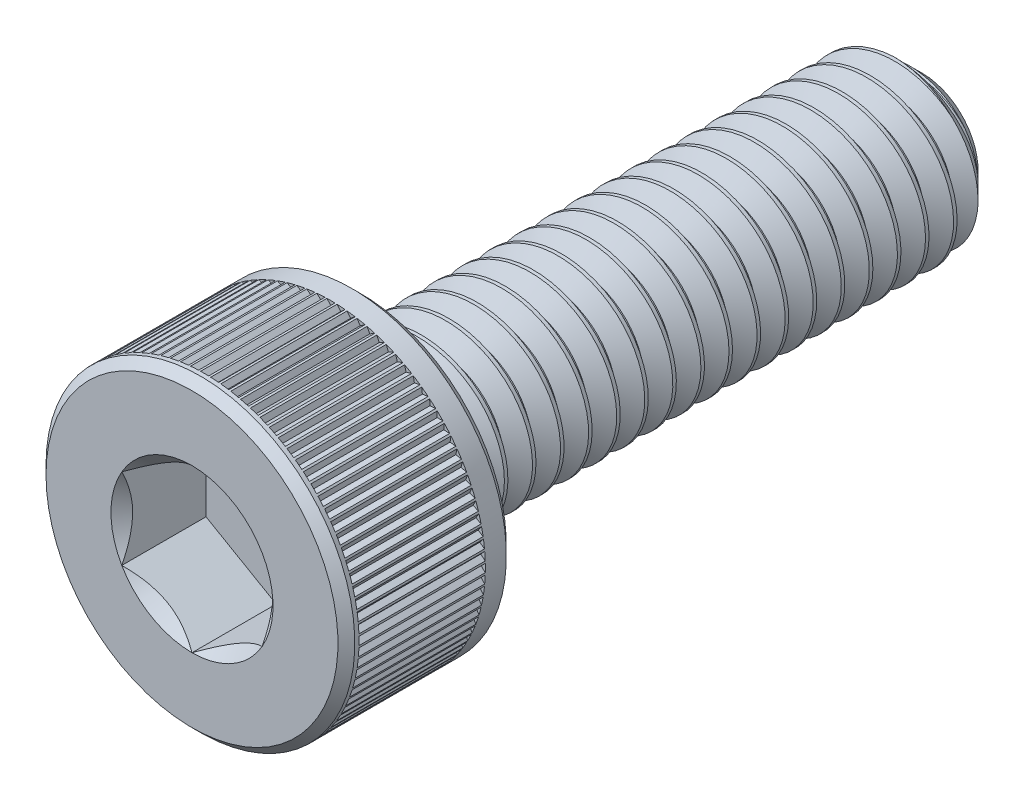
from build123d import *

# Parameters (mm, degrees)
CUT_EXTRUDE1_START = -1.5
CUT_EXTRUDE1_DEPTH = 1.5
SKETCH4_R          = 1.443375673
CUT_EXTRUDE2_DEPTH = 0.5
CUT_EXTRUDE2_DRAFT = -45
CUT_SWEEP1_PITCH   = 0.5
CUT_SWEEP1_TO      = 10
CUT_EXTRUDE4_START = -0.975
CUT_EXTRUDE4_DEPTH = 2.25
CIRPATTERN2_COUNT  = 96


with BuildPart() as part:
    # Sketch2 → Revolve1 (revolve)
    with BuildSketch(Plane(origin=(0, 0, 0), x_dir=(0, 0, -1), z_dir=(1, 0, 0)), mode=Mode.PRIVATE) as revolve1_sk:
        Polygon((-6.35, 2.75), (-3.65, 2.75), (-3.5, 2.6), (-3.5, 1.5), (6, 1.5), (6.5, 1), (6.5, 0), (-6.5, 0), (-6.5, 2.6), align=None)
    revolve(revolve1_sk.sketch.rotate(Axis((0, 0, -6.5), (0, 0, 1)), 90), axis=Axis((0, 0, -6.5), (0, 0, 1)))

    # Sketch3 → Cut-Extrude1 (cut)
    with BuildSketch(Plane.XY.offset(6.5).offset(CUT_EXTRUDE1_START)):
        Polygon((0, 1.443375673), (-1.25, 0.721687836), (-1.25, -0.721687836), (0, -1.443375673), (1.25, -0.721687836), (1.25, 0.721687836), align=None)
    extrude(amount=CUT_EXTRUDE1_DEPTH, mode=Mode.SUBTRACT)


with BuildPart() as cut_extrude2_tool:
    # Sketch4 → Cut-Extrude2 (with draft: the straight prism first)
    with BuildSketch(Plane.XY.offset(6.5)):
        Circle(SKETCH4_R)
    extrude(amount=-CUT_EXTRUDE2_DEPTH)
    # Cut-Extrude2: the draft: its side faces are tilted about the plane it starts from
    cut_extrude2_sides = [cut_extrude2_tool.faces().sort_by_distance(p)[0] for p in [
        (-1.443375673, 0, 6.25),
    ]]
    draft(cut_extrude2_sides, Plane.XY.offset(6.5), CUT_EXTRUDE2_DRAFT)


with BuildPart() as part_1:
    add(part.part)

    # Cut-Extrude2: cut by cut_extrude2_tool
    add(cut_extrude2_tool.part, mode=Mode.SUBTRACT)


with BuildPart() as body_2:
    # Split1: read off the stored shape, not the designer's step
    # Split1: the piece on the far side of the plane
    add(part_1.part)
    split(bisect_by=Plane.XY.offset(3.5), keep=Keep.BOTTOM)

    # Cut-Sweep1: arcs per turn and ends read off the stored shape
    # Cut-Sweep1: the profile of Sketch7 screwed along a right-hand helix through 21 turns, 6 arcs to a turn; built about Z, then put on its axis
    cut_sweep1_z = Axis((0, 0, 0), (0, 0, 1))
    cut_sweep1_corners = [(1.527063294, 0, 0.015625), (1.527063294, 0, -0.453125), (1.175240474, 0, -0.25), (1.175240474, 0, -0.1875)]
    with BuildLine(mode=Mode.PRIVATE) as cut_sweep1_profile:
        Line(cut_sweep1_corners[0], cut_sweep1_corners[1])
        Line(cut_sweep1_corners[1], cut_sweep1_corners[2])
        Line(cut_sweep1_corners[2], cut_sweep1_corners[3])
        Line(cut_sweep1_corners[3], cut_sweep1_corners[0])
    cut_sweep1_cap = Face(cut_sweep1_profile.wire())
    cut_sweep1_turn_angles = [0, 30, 60, 90, 120, 150, 180, 210, 240, 270, 300, 330, 360]
    cut_sweep1_turn_weights = [1, 0.8660254037844387, 1, 0.8660254037844387, 1, 0.8660254037844387, 1, 0.8660254037844387, 1, 0.8660254037844387, 1, 0.8660254037844387, 1]
    cut_sweep1_turn_rails = [Edge.make_bspline([Vector(p[0], p[1], 0).rotate(cut_sweep1_z, cut_sweep1_turn_angles[k]) / cut_sweep1_turn_weights[k] + Vector(0, 0, p[2] + CUT_SWEEP1_PITCH * cut_sweep1_turn_angles[k] / 360) for k in range(13)], [0, 0, 0, 1, 1, 2, 2, 3, 3, 4, 4, 5, 5, 6, 6, 6], 2, cut_sweep1_turn_weights) for p in cut_sweep1_corners]
    cut_sweep1_turn_sides = [Face.make_surface_from_curves(cut_sweep1_turn_rails[p[0]], cut_sweep1_turn_rails[p[1]]) for p in [(0, 1), (1, 2), (2, 3), (3, 0)]]
    cut_sweep1 = Plane(origin=(0, 0, -6.5), x_dir=(0, 1, 0), z_dir=(0, 0, 1)) * split(Solid(Shell([*[p.moved(Location((0, 0, CUT_SWEEP1_PITCH * i))) for i in range(21) for p in cut_sweep1_turn_sides], cut_sweep1_cap, cut_sweep1_cap.rotate(cut_sweep1_z, 7560).moved(Location((0, 0, CUT_SWEEP1_PITCH * 7560 / 360)))])), bisect_by=Plane.XY.offset(CUT_SWEEP1_TO), keep=Keep.BOTTOM, mode=Mode.PRIVATE)
    add(cut_sweep1, mode=Mode.SUBTRACT)


with BuildPart() as part_2:
    add(part_1.part)

    # Split1
    split(bisect_by=Plane.XY.offset(3.5), keep=Keep.TOP)

    add(body_2.part)  # Boss-Extrude1 merges body 2
    # Boss-Extrude1: read off the stored shape, not the designer's step
    # Boss-Extrude1 outline → Boss-Extrude1 (revolve)
    with BuildSketch(Plane.XZ):
        Polygon((1.175238158, 3.5), (1.175238158, 3.175238158), (1.5, 3.5), align=None)
    revolve(axis=Axis((0, 0, 0), (0, 0, 1)))

    # Sketch9 → Cut-Extrude4 (cut)
    with BuildSketch(Plane.XY.offset(5).offset(CUT_EXTRUDE4_START)):
        with BuildLine():
            Line((0, 2.674375), (0.071986608, 2.749057644))
            ThreePointArc((0.071986608, 2.749057644), (0, 2.75), (-0.071986608, 2.749057644))
            Line((-0.071986608, 2.749057644), (0, 2.674375))
        make_face()
    cut_extrude4 = extrude(amount=CUT_EXTRUDE4_DEPTH, mode=Mode.SUBTRACT)

    # CirPattern2: Cut-Extrude4 ×96 about axis
    cirpattern2_axis = Axis((0, 0, 0), (0, 0, 1))
    for i in range(1, CIRPATTERN2_COUNT):
        add(cut_extrude4.rotate(cirpattern2_axis, i * 360 / CIRPATTERN2_COUNT), mode=Mode.SUBTRACT)


solid = part_2.part
